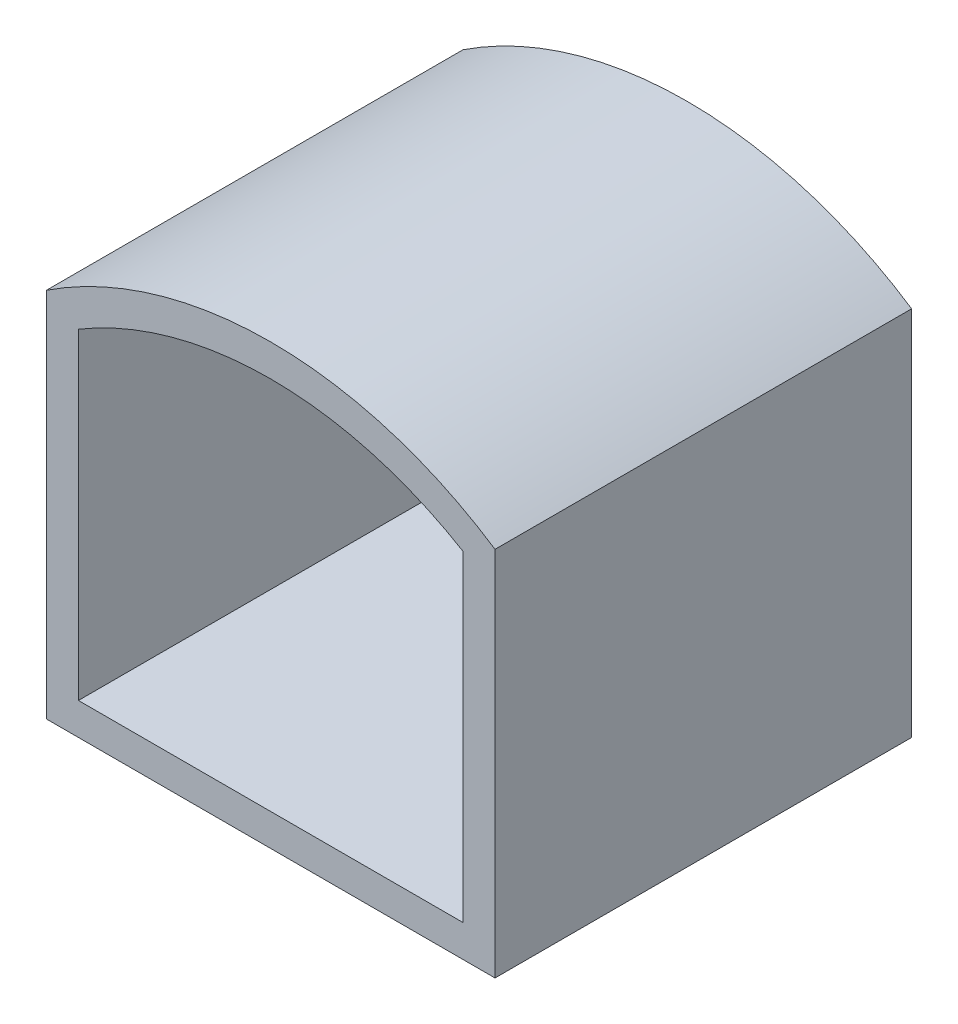
from build123d import *

# Parameters (mm, degrees)
BOSS_EXTRUDE1_DEPTH = 120
SHELL1_T            = 10


with BuildPart() as part:
    # Sketch1 → Boss-Extrude1 (new body)
    with BuildSketch(Plane.XY):
        with BuildLine():
            Line((60, -50.165), (-60, -50.165))
            Line((-60, -50.165), (-60, 50.165))
            ThreePointArc((-60, 50.165), (0, 66.737133856), (60, 50.165))
            Line((60, 50.165), (60, -50.165))
        make_face()
    extrude(amount=BOSS_EXTRUDE1_DEPTH)

    # Shell1
    shell1_openings = [part.faces().sort_by_distance(p)[0] for p in [
        (0, 5.714349626, 120),
    ]]
    offset(amount=SHELL1_T, openings=shell1_openings, kind=Kind.INTERSECTION)


solid = part.part
